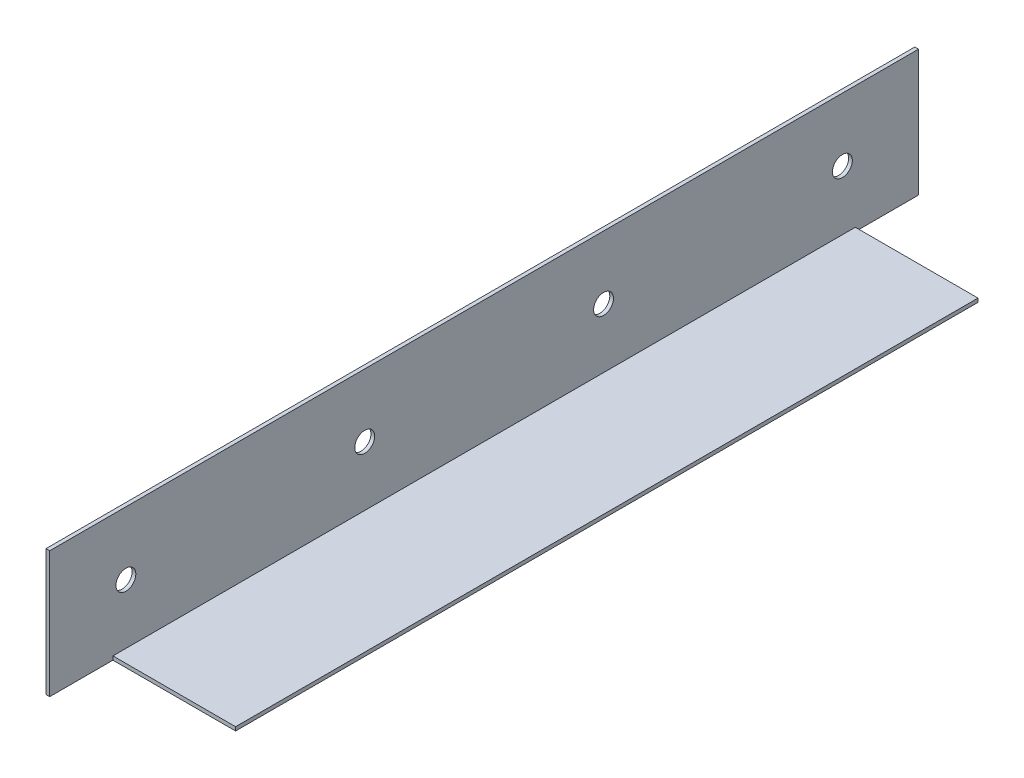
from build123d import *

# Parameters (mm, degrees)
SALIENTE_EXTRUIR1_DEPTH = 349.2
CROQUIS2_R              = 4
CORTAR_EXTRUIR1_DEPTH   = 2
CROQUIS4_W              = 49.3
CROQUIS4_H              = 25.4
CORTAR_EXTRUIR2_DEPTH   = 2


with BuildPart() as part:
    # Croquis1 → Saliente-Extruir1 (new body)
    with BuildSketch(Plane.XY):
        Polygon((0, 0), (0, 50.8), (1.5, 50.8), (1.5, 1.5), (50.8, 1.5), (50.8, 0), align=None)
    extrude(amount=SALIENTE_EXTRUIR1_DEPTH)

    # Croquis2 → Cortar-Extruir1 (cut)
    with BuildSketch(Plane.ZY):
        with Locations((126.6, 25.4)):
            Circle(CROQUIS2_R)
        with Locations((222.6, 25.4)):
            Circle(CROQUIS2_R)
        with Locations((30.6, 25.4)):
            Circle(CROQUIS2_R)
        with Locations((318.6, 25.4)):
            Circle(CROQUIS2_R)
    extrude(amount=-CORTAR_EXTRUIR1_DEPTH, mode=Mode.SUBTRACT)

    # Croquis4 → Cortar-Extruir2 (cut)
    with BuildSketch(Plane(origin=(0, 1.5, 0), x_dir=(1, 0, 0), z_dir=(0, 1, 0))):
        with Locations((26.15, -12.7)):
            Rectangle(CROQUIS4_W, CROQUIS4_H)
        with Locations((26.15, -336.5)):
            Rectangle(CROQUIS4_W, CROQUIS4_H)
    extrude(amount=-CORTAR_EXTRUIR2_DEPTH, mode=Mode.SUBTRACT)


solid = part.part
